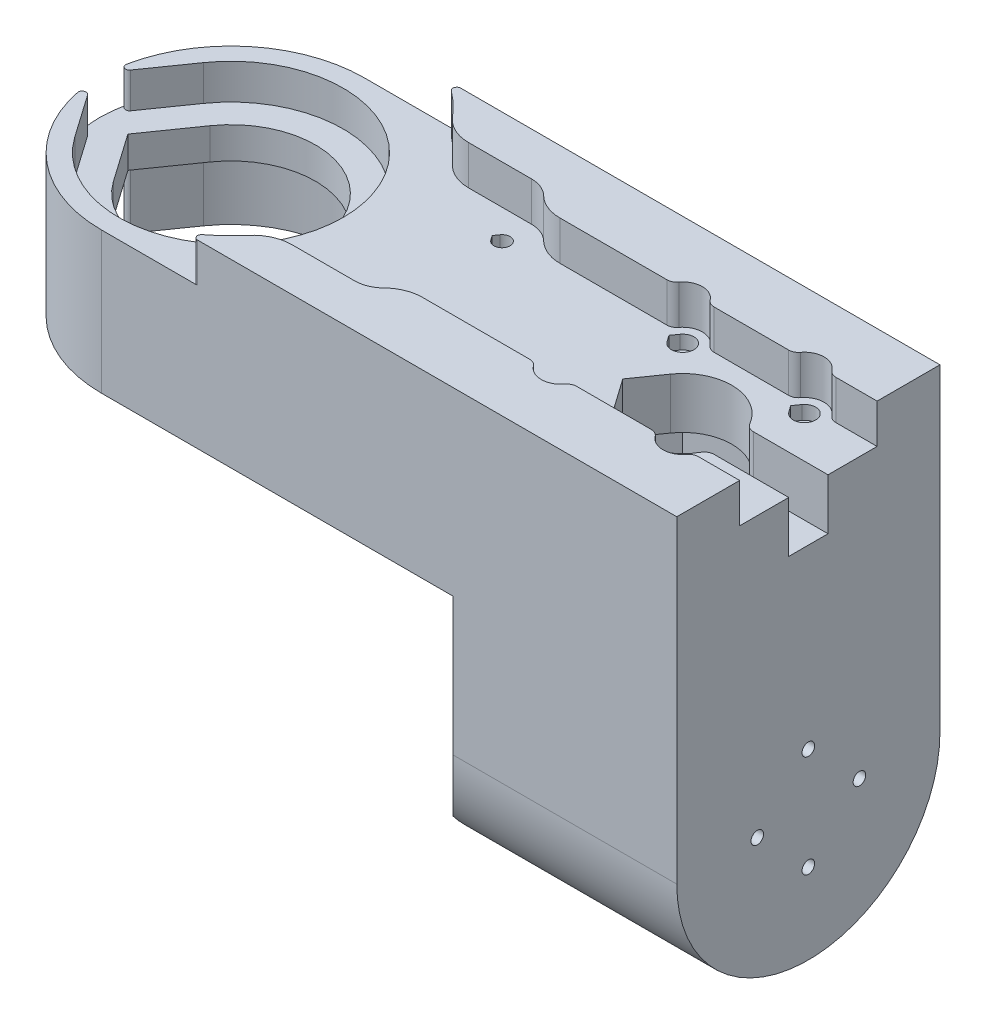
from build123d import *
from OCP.BRepFilletAPI import BRepFilletAPI_MakeChamfer

# Parameters (mm, degrees)
BOSS_EXTRUDE1_DEPTH     = 67
CUT_EXTRUDE1_DEPTH      = 199.010732032
CUT_EXTRUDE1_DEPTH_BACK = 199.010732032
FILLET3_R               = 34
CUT_EXTRUDE2_DEPTH      = 199.010732032
CUT_EXTRUDE2_DEPTH_BACK = 10
CUT_EXTRUDE3_START      = -10
CUT_EXTRUDE3_DEPTH      = 9
CUT_EXTRUDE4_START      = -27
CUT_EXTRUDE4_DEPTH      = 19
CUT_EXTRUDE5_DEPTH      = 13
CUT_EXTRUDE6_DEPTH      = 3.5
CUT_EXTRUDE7_DEPTH      = 10
CUT_EXTRUDE8_DEPTH      = 7
CUT_EXTRUDE18_REACH     = 200.011
CUT_EXTRUDE11_START     = -10
CUT_EXTRUDE11_DEPTH     = 10
CUT_EXTRUDE12_START     = -10
CUT_EXTRUDE12_DEPTH     = 7
CUT_EXTRUDE13_START     = -17
CUT_EXTRUDE13_DEPTH     = 3
FILLET5_R               = 2.5
FILLET1_R               = 10
FILLET2_R               = 2.5
FILLET4_R               = 1
CHAMFER7_SIZE           = 12
CHAMFER5_SIZE           = 9.5
SKETCH11_R              = 1.6
CUT_EXTRUDE19_DEPTH     = 201.29726975
SKETCH11_3_R            = 2.85
CUT_EXTRUDE20_DEPTH     = 3.5
CHAMFER6_SIZE           = 7
CUT_EXTRUDE16_REACH     = 210.875
CHAMFER8_SIZE           = 5
CHAMFER8_SIZE2          = 3.535533906
CUT_EXTRUDE21_START     = -10
CUT_EXTRUDE21_DEPTH     = 10


# Some blends are built 0.0001 mm under size
with BuildPart() as part:
    # Sketch1 → Boss-Extrude1 (new body)
    with BuildSketch(Plane(origin=(0, 0, 0), x_dir=(0, 1, 0), z_dir=(0, 0, 1))):
        Polygon((35, 33.5), (35, -83), (-33.5, -83), (-33.5, -147), (81, -147), (81, 33.5), align=None)
    extrude(amount=BOSS_EXTRUDE1_DEPTH)

    # Sketch2 → Cut-Extrude1 (cut, two sides: drawn at the far end of the back side and taken through both)
    with BuildSketch(Plane(origin=(0, 81, 0), x_dir=(-1, 0, 0), z_dir=(0, 1, 0)).offset(-CUT_EXTRUDE1_DEPTH_BACK)):
        with BuildLine():
            Line((17.611768952, 21.168106618), (26.246653658, 33.5))
            Line((26.246653658, 33.5), (17.611768952, 45.831893382))
            ThreePointArc((17.611768952, 45.831893382), (-21.5, 33.5), (17.611768952, 21.168106618))
        make_face()
    extrude(amount=CUT_EXTRUDE1_DEPTH + CUT_EXTRUDE1_DEPTH_BACK, mode=Mode.SUBTRACT)

    # Fillet3
    # the kernel refuses this fillet: 34 mm, written as the material it takes off along each edge
    with BuildSketch(Plane(origin=(-33.5, 166, 0), x_dir=(0, 0, 1), z_dir=(0, -1, 0))) as fillet3_piece_1:
        with BuildLine():
            CenterArc((FILLET3_R, -FILLET3_R), FILLET3_R, 90, 90)
            Line((0, -FILLET3_R), (0, 0))
            Line((0, 0), (FILLET3_R, 0))
        make_face()
    extrude(amount=216, mode=Mode.SUBTRACT)
    with BuildSketch(Plane(origin=(-33.5, 166, 67), x_dir=(0, 0, -1), z_dir=(0, -1, 0))) as fillet3_piece_2:
        with BuildLine():
            CenterArc((FILLET3_R, FILLET3_R), FILLET3_R, 180, 90)
            Line((0, FILLET3_R), (0, 0))
            Line((0, 0), (FILLET3_R, 0))
        make_face()
    extrude(amount=216, mode=Mode.SUBTRACT)

    # Sketch2<4> → Cut-Extrude2 (cut, two sides: drawn at the far end of the back side and taken through both)
    with BuildSketch(Plane(origin=(0, 81, 0), x_dir=(-1, 0, 0), z_dir=(0, 1, 0)).offset(-CUT_EXTRUDE2_DEPTH_BACK)):
        with BuildLine():
            Line((-147, 16), (-147, 51))
            Line((-147, 51), (-135.082575695, 51))
            ThreePointArc((-135.082575695, 51), (-130.5, 54), (-125.917424305, 51))
            Line((-125.917424305, 51), (-104.082575695, 51))
            ThreePointArc((-104.082575695, 51), (-99.5, 54), (-94.917424305, 51))
            Line((-94.917424305, 51), (-61.071067812, 51))
            ThreePointArc((-61.071067812, 51), (-58.330127019, 54.623724357), (-54, 56))
            Line((-54, 56), (-33.071891388, 56))
            ThreePointArc((-33.071891388, 56), (-28.009986026, 62.055922027), (-21.857492994, 67))
            Line((-21.857492994, 67), (33.5, 67))
            Line((33.5, 67), (33.5, 0))
            Line((33.5, 0), (-21.857492994, 0))
            ThreePointArc((-21.857492994, 0), (-28.009986026, 4.944077973), (-33.071891388, 11))
            Line((-33.071891388, 11), (-54, 11))
            ThreePointArc((-54, 11), (-58.330127019, 12.376275643), (-61.071067812, 16))
            Line((-61.071067812, 16), (-94.917424305, 16))
            ThreePointArc((-94.917424305, 16), (-99.5, 13), (-104.082575695, 16))
            Line((-104.082575695, 16), (-125.917424305, 16))
            ThreePointArc((-125.917424305, 16), (-130.5, 13), (-135.082575695, 16))
            Line((-135.082575695, 16), (-147, 16))
        make_face()
    extrude(amount=CUT_EXTRUDE2_DEPTH + CUT_EXTRUDE2_DEPTH_BACK, mode=Mode.SUBTRACT)

    # Sketch2<5> → Cut-Extrude3 (cut)
    with BuildSketch(Plane(origin=(0, 81, 0), x_dir=(-1, 0, 0), z_dir=(0, 1, 0)).offset(CUT_EXTRUDE3_START)):
        with BuildLine():
            Line((23.386790864, 17.124392742), (34.853114509, 33.5))
            Line((34.853114509, 33.5), (23.386790864, 49.875607258))
            ThreePointArc((23.386790864, 49.875607258), (-28.55, 33.5), (23.386790864, 17.124392742))
        make_face()
    extrude(amount=-CUT_EXTRUDE3_DEPTH, mode=Mode.SUBTRACT)

    # Sketch2<6> → Cut-Extrude4 (cut)
    with BuildSketch(Plane(origin=(0, 81, 0), x_dir=(-1, 0, 0), z_dir=(0, 1, 0)).offset(CUT_EXTRUDE4_START)):
        with BuildLine():
            Line((23.386790864, 17.124392742), (34.853114509, 33.5))
            Line((34.853114509, 33.5), (23.386790864, 49.875607258))
            ThreePointArc((23.386790864, 49.875607258), (-28.55, 33.5), (23.386790864, 17.124392742))
        make_face()
    extrude(amount=-CUT_EXTRUDE4_DEPTH, mode=Mode.SUBTRACT)

    # Sketch3 → Cut-Extrude5 (cut)
    with BuildSketch(Plane(origin=(0, 71, 0), x_dir=(-1, 0, 0), z_dir=(0, 1, 0))):
        with BuildLine():
            Line((-99.74031764, 33.5), (-104.333810411, 40.01785238))
            ThreePointArc((-104.333810411, 40.01785238), (-115.855624093, 45.970681914), (-126.456439237, 38.5))
            Line((-126.456439237, 38.5), (-147, 38.5))
            Line((-147, 38.5), (-147, 28.5))
            Line((-147, 28.5), (-126.456439237, 28.5))
            ThreePointArc((-126.456439237, 28.5), (-116.243865439, 21.062042018), (-104.760599446, 26.330294546))
            Line((-104.760599446, 26.330294546), (-99.74031764, 33.5))
        make_face()
        with BuildLine():
            Line((-129.22, 49.96), (-128.5, 49))
            Line((-128.5, 49), (-129.22, 48.04))
            ThreePointArc((-129.22, 48.04), (-132.1, 49), (-129.22, 49.96))
        make_face()
        with BuildLine():
            Line((-98.22, 48.04), (-97.5, 49))
            Line((-97.5, 49), (-98.22, 49.96))
            ThreePointArc((-98.22, 49.96), (-101.1, 49), (-98.22, 48.04))
        make_face()
        with BuildLine():
            Line((-98.22, 17.04), (-97.5, 18))
            Line((-97.5, 18), (-98.22, 18.96))
            ThreePointArc((-98.22, 18.96), (-101.1, 18), (-98.22, 17.04))
        make_face()
        with BuildLine():
            Line((-129.22, 17.04), (-128.5, 18))
            Line((-128.5, 18), (-129.22, 18.96))
            ThreePointArc((-129.22, 18.96), (-132.1, 18), (-129.22, 17.04))
        make_face()
    extrude(amount=-CUT_EXTRUDE5_DEPTH, mode=Mode.SUBTRACT)

    # Sketch3<3> → Cut-Extrude6 (cut)
    with BuildSketch(Plane(origin=(0, 71, 0), x_dir=(-1, 0, 0), z_dir=(0, 1, 0))):
        with BuildLine():
            Line((-128.179285714, 50.654323186), (-127, 49))
            Line((-127, 49), (-128.179285714, 47.345676814))
            ThreePointArc((-128.179285714, 47.345676814), (-133.35, 49), (-128.179285714, 50.654323186))
        make_face()
        with BuildLine():
            Line((-96, 49), (-97.179285714, 47.345676814))
            ThreePointArc((-97.179285714, 47.345676814), (-102.35, 49), (-97.179285714, 50.654323186))
            Line((-97.179285714, 50.654323186), (-96, 49))
        make_face()
        with BuildLine():
            Line((-96, 18), (-97.179285714, 16.345676814))
            ThreePointArc((-97.179285714, 16.345676814), (-102.35, 18), (-97.179285714, 19.654323186))
            Line((-97.179285714, 19.654323186), (-96, 18))
        make_face()
        with BuildLine():
            Line((-127, 18), (-128.179285714, 16.345676814))
            ThreePointArc((-128.179285714, 16.345676814), (-133.35, 18), (-128.179285714, 19.654323186))
            Line((-128.179285714, 19.654323186), (-127, 18))
        make_face()
    extrude(amount=-CUT_EXTRUDE6_DEPTH, mode=Mode.SUBTRACT)

    # Sketch4 → Cut-Extrude7 (cut)
    with BuildSketch(Plane(origin=(0, 71, 0), x_dir=(-1, 0, 0), z_dir=(0, 1, 0))):
        with BuildLine():
            Line((-52.689356729, 49.417722298), (-52.046760658, 48.5))
            Line((-52.046760658, 48.5), (-52.689356729, 47.582277702))
            ThreePointArc((-52.689356729, 47.582277702), (-55.6, 48.5), (-52.689356729, 49.417722298))
        make_face()
        with BuildLine():
            Line((-52.689356729, 19.417722298), (-52.046760658, 18.5))
            Line((-52.046760658, 18.5), (-52.689356729, 17.582277702))
            ThreePointArc((-52.689356729, 17.582277702), (-55.6, 18.5), (-52.689356729, 19.417722298))
        make_face()
    extrude(amount=-CUT_EXTRUDE7_DEPTH, mode=Mode.SUBTRACT)

    # Sketch4<3> → Cut-Extrude8 (cut)
    # profile 1 of 2: a face of its own
    with BuildSketch(Plane(origin=(0, 71, 0), x_dir=(-1, 0, 0), z_dir=(0, 1, 0))):
        with BuildLine():
            Line((-51.497412093, 48.5), (-52.320738309, 47.324168305))
            ThreePointArc((-52.320738309, 47.324168305), (-56.05, 48.5), (-52.320738309, 49.675831695))
            Line((-52.320738309, 49.675831695), (-51.497412093, 48.5))
        make_face()
        with BuildLine():
            Line((-52.689356729, 49.417722298), (-52.046760658, 48.5))
            Line((-52.046760658, 48.5), (-52.689356729, 47.582277702))
            ThreePointArc((-52.689356729, 47.582277702), (-55.6, 48.5), (-52.689356729, 49.417722298))
        make_face(mode=Mode.SUBTRACT)
    # profile 2 of 2: a face of its own
    with BuildSketch(Plane(origin=(0, 71, 0), x_dir=(-1, 0, 0), z_dir=(0, 1, 0))):
        with BuildLine():
            Line((-51.497412093, 18.5), (-52.320738309, 17.324168305))
            ThreePointArc((-52.320738309, 17.324168305), (-56.05, 18.5), (-52.320738309, 19.675831695))
            Line((-52.320738309, 19.675831695), (-51.497412093, 18.5))
        make_face()
        with BuildLine():
            Line((-52.689356729, 19.417722298), (-52.046760658, 18.5))
            Line((-52.046760658, 18.5), (-52.689356729, 17.582277702))
            ThreePointArc((-52.689356729, 17.582277702), (-55.6, 18.5), (-52.689356729, 19.417722298))
        make_face(mode=Mode.SUBTRACT)
    extrude(amount=-CUT_EXTRUDE8_DEPTH, mode=Mode.SUBTRACT)

    # Cut-Extrude18: up to this face of the body (flat: up to its plane)
    cut_extrude18_end = Plane(part.part.faces().sort_by_distance((120.971111033, 58, 33.49934117))[0])
    # Sketch10 → Cut-Extrude18 (cut, up to the picked face)
    with BuildSketch(Plane.XZ.offset(33.5), mode=Mode.PRIVATE) as cut_extrude18_sk1:
        Polygon((93, 55.5), (137, 55.5), (137, 11.5), (93, 11.5), (93, 23.5), (83, 23.5), (83, 43.5), (93, 43.5), align=None)
    cut_extrude18_tool1 = split(extrude(cut_extrude18_sk1.sketch, amount=-CUT_EXTRUDE18_REACH, mode=Mode.PRIVATE), bisect_by=cut_extrude18_end, keep=Keep.BOTH, mode=Mode.PRIVATE)
    add(cut_extrude18_tool1.solids().sort_by(Axis((112.47191, -33.5, 33.5), (0, 1, 0)))[0], mode=Mode.SUBTRACT)

    # Sketch6 → Cut-Extrude11 (cut)
    with BuildSketch(Plane.XZ.offset(-35).offset(CUT_EXTRUDE11_START)):
        with BuildLine():
            Line((83, 36), (83, 31))
            Line((83, 31), (61.331732852, 31))
            Line((61.331732852, 31), (51.331732852, 23.5))
            Line((51.331732852, 23.5), (46.331732852, 23.5))
            Line((46.331732852, 23.5), (46.331732852, 11.134248627))
            Line((46.331732852, 11.134248627), (39.431732852, 11.134248627))
            Line((39.431732852, 11.134248627), (17.744736277, 11.134248627))
            ThreePointArc((17.744736277, 11.134248627), (28.383056062, 30.417042236), (22.132970349, 51.534248627))
            Line((22.132970349, 51.534248627), (39.431732852, 51.534248627))
            Line((39.431732852, 51.534248627), (46.331732852, 51.534248627))
            Line((46.331732852, 51.534248627), (46.331732852, 43.5))
            Line((46.331732852, 43.5), (51.331732852, 43.5))
            Line((51.331732852, 43.5), (61.331732852, 36))
            Line((61.331732852, 36), (83, 36))
        make_face()
    extrude(amount=CUT_EXTRUDE11_DEPTH, mode=Mode.SUBTRACT)

    # Sketch6<4> → Cut-Extrude12 (cut)
    with BuildSketch(Plane.XZ.offset(-35).offset(CUT_EXTRUDE12_START)):
        with BuildLine():
            Line((36.929144946, 16.334248627), (37.752471162, 17.510080322))
            ThreePointArc((37.752471162, 17.510080322), (41.481732852, 16.334248627), (37.752471162, 15.158416933))
            Line((37.752471162, 15.158416933), (36.929144946, 16.334248627))
        make_face()
        with BuildLine():
            Line((36.929144946, 46.334248627), (37.752471162, 47.510080322))
            ThreePointArc((37.752471162, 47.510080322), (41.481732852, 46.334248627), (37.752471162, 45.158416933))
            Line((37.752471162, 45.158416933), (36.929144946, 46.334248627))
        make_face()
    extrude(amount=-CUT_EXTRUDE12_DEPTH, mode=Mode.SUBTRACT)

    # Sketch6<5> → Cut-Extrude13 (cut)
    with BuildSketch(Plane.XZ.offset(-35).offset(CUT_EXTRUDE13_START)):
        with BuildLine():
            Line((38.121089582, 15.416526329), (37.47849351, 16.334248627))
            Line((37.47849351, 16.334248627), (38.121089582, 17.251970925))
            ThreePointArc((38.121089582, 17.251970925), (41.031732852, 16.334248627), (38.121089582, 15.416526329))
        make_face()
        with BuildLine():
            Line((38.121089582, 45.416526329), (37.47849351, 46.334248627))
            Line((37.47849351, 46.334248627), (38.121089582, 47.251970925))
            ThreePointArc((38.121089582, 47.251970925), (41.031732852, 46.334248627), (38.121089582, 45.416526329))
        make_face()
    extrude(amount=-CUT_EXTRUDE13_DEPTH, mode=Mode.SUBTRACT)

    # Fillet5
    fillet5_edges = [part.edges().sort_by_distance(p)[0] for p in [
        (46.331732852, 40, 23.5),
        (46.331732852, 40, 43.5),
        (51.331732852, 40, 43.5),
        (61.331732852, 40, 36),
        (61.331732852, 40, 31),
        (51.331732852, 40, 23.5),
    ]]
    fillet(fillet5_edges, radius=FILLET5_R)

    # Fillet1
    fillet1_edges = [part.edges().sort_by_distance(p)[0] for p in [
        (61.071067812, 76, 51),
        (33.071891388, 76, 56),
        (33.071891388, 76, 11),
        (61.071067812, 76, 16),
    ]]
    fillet(fillet1_edges, radius=FILLET1_R)

    # Fillet2
    fillet2_edges = [part.edges().sort_by_distance(p)[0] for p in [
        (94.917424305, 76, 16),
        (104.082575695, 76, 16),
        (125.917424305, 76, 16),
        (126.456439237, 64.5, 38.5),
        (126.456439237, 64.5, 28.5),
        (135.082575695, 76, 16),
        (135.082575695, 76, 51),
        (125.917424305, 76, 51),
        (104.082575695, 76, 51),
        (94.917424305, 76, 51),
    ]]
    fillet(fillet2_edges, radius=FILLET2_R)

    # Fillet4
    fillet4_edges = [part.edges().sort_by_distance(p)[0] for p in [
        (-33.402614008, 66.5, 35.5715294),
        (-33.402614008, 66.5, 31.4284706),
        (-33.402614008, 44.5, 35.5715294),
        (-33.402614008, 44.5, 31.4284706),
        (21.857492994, 76, 67),
        (21.857492994, 76, 0),
    ]]
    fillet(fillet4_edges, radius=FILLET4_R)

    # Chamfer7
    # the kernel refuses this chamfer: 12 mm, written as the material it takes off along each edge
    with BuildSketch(Plane(origin=(93, -64.360195856, 43.5), x_dir=(0.02749587661058678, 0, 0.9996219169112968), z_dir=(0, 1, 0))) as chamfer7_piece_1_section:
        Polygon((CHAMFER7_SIZE * 0.999621916911, -CHAMFER7_SIZE * 0.0274958766106), (-CHAMFER7_SIZE * 0.0274958766106, -CHAMFER7_SIZE * 0.999621916911), (0, 0), align=None)
    chamfer7_piece_1 = extrude(amount=122.360195856, mode=Mode.PRIVATE)
    chamfer7_piece_1 = split(chamfer7_piece_1, bisect_by=Plane(origin=(83, 0.75, 52.5), z_dir=(1, 0, 0)), keep=Keep.TOP, mode=Mode.PRIVATE)
    add(chamfer7_piece_1, mode=Mode.SUBTRACT)
    with BuildSketch(Plane(origin=(93, -64.360195856, 23.5), x_dir=(-0.9996219169112965, 0, 0.02749587661058705), z_dir=(0, 1, 0))) as chamfer7_piece_2_section:
        Polygon((CHAMFER7_SIZE * 0.999621916911, -CHAMFER7_SIZE * 0.0274958766106), (-CHAMFER7_SIZE * 0.0274958766106, -CHAMFER7_SIZE * 0.999621916911), (0, 0), align=None)
    chamfer7_piece_2 = extrude(amount=122.360195856, mode=Mode.PRIVATE)
    chamfer7_piece_2 = split(chamfer7_piece_2, bisect_by=Plane(origin=(83, 0.75, 20.234168406), z_dir=(1, 0, 0)), keep=Keep.TOP, mode=Mode.PRIVATE)
    add(chamfer7_piece_2, mode=Mode.SUBTRACT)

    # Chamfer5
    chamfer5_edges = [part.edges().sort_by_distance(p)[0] for p in [
        (83, 40, 36),
        (83, 40, 31),
    ]]
    chamfer(chamfer5_edges, length=CHAMFER5_SIZE - 0.0001)  # a hair under: the kernel refuses the full size

    # Sketch11 → Cut-Extrude19 (cut, through all)
    with BuildSketch(Plane(origin=(137, 0, 0), x_dir=(0, -1, 0), z_dir=(-1, 0, 0))):
        with Locations((0, 46.5)):
            Circle(SKETCH11_R)
        with Locations((13, 33.5)):
            Circle(SKETCH11_R)
        with Locations((0, 20.5)):
            Circle(SKETCH11_R)
        with Locations((-13, 33.5)):
            Circle(SKETCH11_R)
    extrude(amount=-CUT_EXTRUDE19_DEPTH, mode=Mode.SUBTRACT)

    # Sketch11<3> → Cut-Extrude20 (cut)
    with BuildSketch(Plane(origin=(137, 0, 0), x_dir=(0, -1, 0), z_dir=(-1, 0, 0))):
        with Locations((0, 46.5)):
            Circle(SKETCH11_3_R)
        with Locations((13, 33.5)):
            Circle(SKETCH11_3_R)
        with Locations((0, 20.5)):
            Circle(SKETCH11_3_R)
        with Locations((-13, 33.5)):
            Circle(SKETCH11_3_R)
    extrude(amount=-CUT_EXTRUDE20_DEPTH, mode=Mode.SUBTRACT)

    # Chamfer6
    chamfer6_edges = [part.edges().sort_by_distance(p)[0] for p in [
        (83, 0.75, 0),
        (83, 0.75, 67),
    ]]
    chamfer(chamfer6_edges, length=CHAMFER6_SIZE)

    # Cut-Extrude16: up to this face of the body (flat: up to its plane)
    cut_extrude16_end = Plane(part.part.faces().sort_by_distance((83, 0.75, 52.75))[0])
    # Sketch9 → Cut-Extrude16 (cut, up to the picked face)
    with BuildSketch(Plane.YZ.offset(147), mode=Mode.PRIVATE) as cut_extrude16_sk1:
        with BuildLine():
            Line((0, 67), (-54.532381669, 67))
            Line((-54.532381669, 67), (-54.532381669, 0))
            Line((-54.532381669, 0), (0, 0))
            ThreePointArc((0, 0), (-33.5, 33.5), (0, 67))
        make_face()
    cut_extrude16_tool1 = split(extrude(cut_extrude16_sk1.sketch, amount=-CUT_EXTRUDE16_REACH, mode=Mode.PRIVATE), bisect_by=cut_extrude16_end, keep=Keep.BOTH, mode=Mode.PRIVATE)
    add(cut_extrude16_tool1.solids().sort_by(Axis((147, -39.431118, 33.5), (-1, 0, 0)))[0], mode=Mode.SUBTRACT)

    # Chamfer8: one chamfer whose edges measure the first distance from different faces: ONE call of the kernel's chamfer builder (chamfer() names one face for all edges)
    chamfer8_edges_1 = [part.edges().sort_by_distance(p)[0] for p in [
        (83, 1.861505827, 45.5),
    ]]
    chamfer8_side_1 = [part.faces().sort_by_distance(p)[0] for p in [
        (87.942666778, 14.648131718, 50.442666778),
    ]]
    chamfer8_edges_2 = [part.edges().sort_by_distance(p)[0] for p in [
        (83, 1.861505827, 21.5),
    ]]
    chamfer8_side_2 = [part.faces().sort_by_distance(p)[0] for p in [
        (87.942666778, 14.648131718, 16.557333222),
    ]]
    chamfer8 = BRepFilletAPI_MakeChamfer(part.part.solid().wrapped)
    for e in chamfer8_edges_1:
        chamfer8.Add(CHAMFER8_SIZE, CHAMFER8_SIZE2, e.wrapped, chamfer8_side_1[0].wrapped)  # the first distance lies on this face
    for e in chamfer8_edges_2:
        chamfer8.Add(CHAMFER8_SIZE, CHAMFER8_SIZE2, e.wrapped, chamfer8_side_2[0].wrapped)  # the first distance lies on this face
    add(Compound.cast(chamfer8.Shape()), mode=Mode.REPLACE)

    # Sketch12 → Cut-Extrude21 (cut)
    with BuildSketch(Plane(origin=(83, 0, 0), x_dir=(0, -1, 0), z_dir=(-1, 0, 0)).offset(CUT_EXTRUDE21_START)):
        with BuildLine():
            Line((25.263610193, 55.5), (25.263610193, 11.5))
            ThreePointArc((25.263610193, 11.5), (33.5, 33.5), (25.263610193, 55.5))
        make_face()
    extrude(amount=CUT_EXTRUDE21_DEPTH, mode=Mode.SUBTRACT)


solid = part.part
